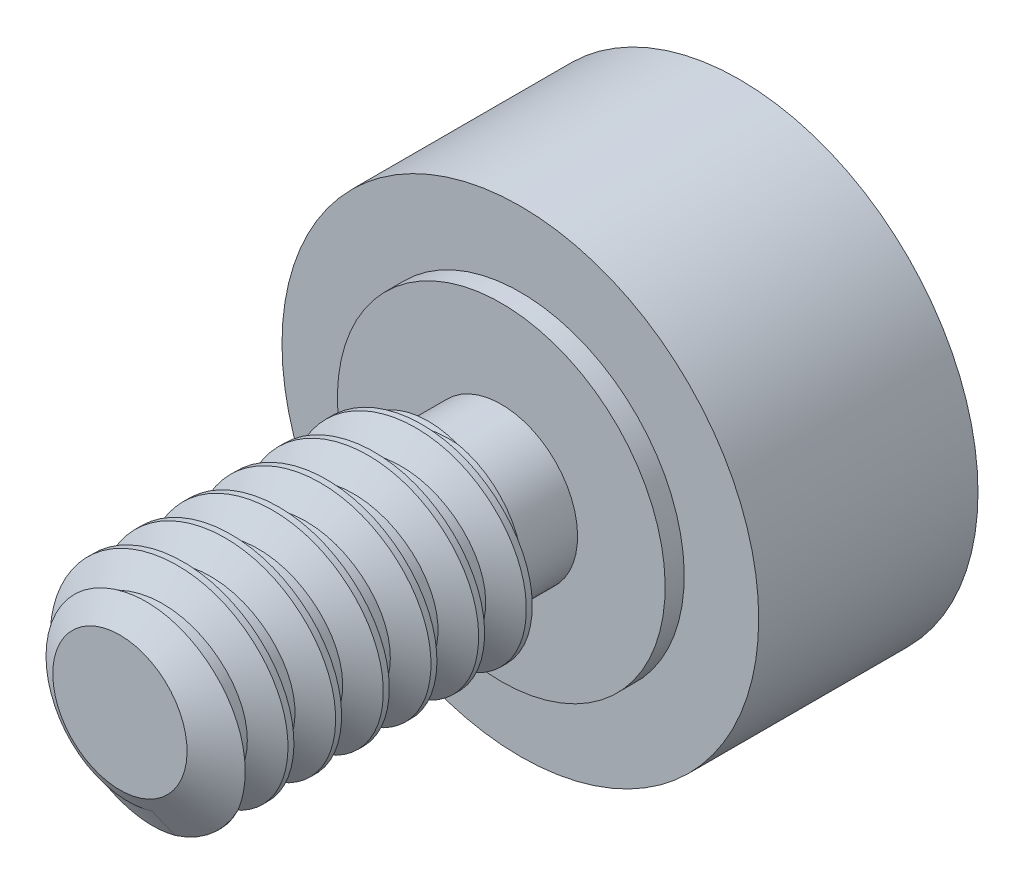
from build123d import *

# Parameters (mm, degrees)
CHAMFER1_SIZE  = 0.3048
CHAMFER1_SIZE2 = 0.527929086
THREAD1_PITCH  = 0.635


with BuildPart() as part:
    # Sketch1 → Revolve1 (revolve)
    with BuildSketch(Plane(origin=(0, 0, 0), x_dir=(0, 0, -1), z_dir=(1, 0, 0)), mode=Mode.PRIVATE) as revolve1_sk:
        Polygon((-5.334, 0), (2.921, 0), (2.921, 3.175), (0, 3.175), (0, 2.1828125), (-0.254, 2.1828125), (-0.254, 1.016), (-1.04775, 1.016), (-1.04775, 1.4224), (-5.334, 1.4224), align=None)
    revolve(revolve1_sk.sketch.rotate(Axis((0, 0, 5.334), (0, 0, -1)), 180), axis=Axis((0, 0, 5.334), (0, 0, -1)))

    # Chamfer1
    chamfer1_edges = [part.edges().sort_by_distance(p)[0] for p in [
        (0, 1.4224, 5.334),
    ]]
    chamfer1_side = [part.faces().sort_by_distance(p)[0] for p in [
        (0, 1.4224, 3.190875),
    ]]
    chamfer(chamfer1_edges, length=CHAMFER1_SIZE, length2=CHAMFER1_SIZE2, reference=chamfer1_side[0])

    # Thread1: the profile of Thread Profile1 profile screwed along a right-hand helix of 7.844803 turns, 6 arcs to a turn; built about Z, then put on its axis
    thread1_z = Axis((0, 0, 0), (0, 0, 1))
    thread1_corners = [(1.4227, 0, -0.000173205), (1.4227, 0, 0.555798203), (1.078696169, 0, 0.357187499), (1.078696169, 0, 0.198437499)]
    with BuildLine(mode=Mode.PRIVATE) as thread1_profile:
        Line(thread1_corners[0], thread1_corners[1])
        Line(thread1_corners[1], thread1_corners[2])
        Line(thread1_corners[2], thread1_corners[3])
        Line(thread1_corners[3], thread1_corners[0])
    thread1_cap = Face(thread1_profile.wire())
    thread1_turn_angles = [0, 30, 60, 90, 120, 150, 180, 210, 240, 270, 300, 330, 360]
    thread1_turn_weights = [1, 0.8660254037844387, 1, 0.8660254037844387, 1, 0.8660254037844387, 1, 0.8660254037844387, 1, 0.8660254037844387, 1, 0.8660254037844387, 1]
    thread1_turn_rails = [Edge.make_bspline([Vector(p[0], p[1], 0).rotate(thread1_z, thread1_turn_angles[k]) / thread1_turn_weights[k] + Vector(0, 0, p[2] + THREAD1_PITCH * thread1_turn_angles[k] / 360) for k in range(13)], [0, 0, 0, 1, 1, 2, 2, 3, 3, 4, 4, 5, 5, 6, 6, 6], 2, thread1_turn_weights) for p in thread1_corners]
    thread1_turn_sides = [Face.make_surface_from_curves(thread1_turn_rails[p[0]], thread1_turn_rails[p[1]]) for p in [(0, 1), (1, 2), (2, 3), (3, 0)]]
    thread1_last_angles = [2520, 2550, 2580, 2610, 2640, 2670, 2700, 2730, 2760, 2790, 2820, 2822.064566929, 2824.129133858]
    thread1_last_weights = [1, 0.8660254037844387, 1, 0.8660254037844387, 1, 0.8660254037844387, 1, 0.8660254037844387, 1, 0.8660254037844387, 1, 0.9993508640214551, 1]
    thread1_last_rails = [Edge.make_bspline([Vector(p[0], p[1], 0).rotate(thread1_z, thread1_last_angles[k]) / thread1_last_weights[k] + Vector(0, 0, p[2] + THREAD1_PITCH * thread1_last_angles[k] / 360) for k in range(13)], [0, 0, 0, 1, 1, 2, 2, 3, 3, 4, 4, 5, 5, 6, 6, 6], 2, thread1_last_weights) for p in thread1_corners]
    thread1_last_sides = [Face.make_surface_from_curves(thread1_last_rails[p[0]], thread1_last_rails[p[1]]) for p in [(0, 1), (1, 2), (2, 3), (3, 0)]]
    thread1 = Plane(origin=(0, 0, 6.0292), x_dir=(-1, 0, 0), z_dir=(0, 0, -1)) * Solid(Shell([*[p.moved(Location((0, 0, THREAD1_PITCH * i))) for i in range(7) for p in thread1_turn_sides], *thread1_last_sides, thread1_cap, thread1_cap.rotate(thread1_z, 2824.129133858).moved(Location((0, 0, THREAD1_PITCH * 2824.129133858 / 360)))]))
    add(thread1, mode=Mode.SUBTRACT)


solid = part.part
